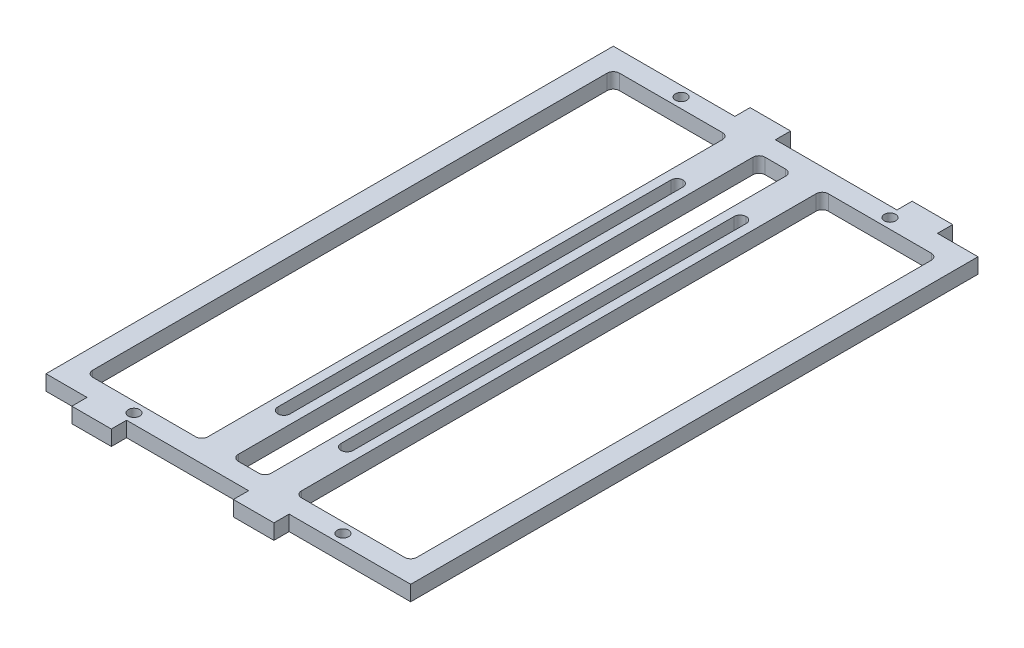
from build123d import *

# Parameters (mm, degrees)
SKETCH1_W                       = 114.3
SKETCH1_H                       = 177.8
SKETCH1_W_2                     = 101.6
SKETCH1_H_2                     = 165.1
BOSS_EXTRUDE1_DEPTH             = 4.7625
SKETCH2_W                       = 12.38677804
SKETCH2_H                       = 4.7625
SKETCH2_W_2                     = 12.7
BOSS_EXTRUDE2_DEPTH             = 4.7625
SKETCH3_W                       = 12.7
SKETCH3_H                       = 4.7625
BOSS_EXTRUDE3_DEPTH             = 4.7625
SKETCH4_W                       = 9.525
SKETCH4_H                       = 177.8
SKETCH4_W_2                     = 3.81
SKETCH4_H_2                     = 127
BOSS_EXTRUDE4_DEPTH             = 4.7625
FILLET1_R                       = 1.905
F_9_64_0_14063_DIAMETER_HOLE1_D = 3.572002


with BuildPart() as part:
    # Sketch1 → Boss-Extrude1 (new body)
    with BuildSketch(Plane(origin=(0, 0, 0), x_dir=(1, 0, 0), z_dir=(0, 1, 0))):
        Rectangle(SKETCH1_W, SKETCH1_H)
        Rectangle(SKETCH1_W_2, SKETCH1_H_2, mode=Mode.SUBTRACT)
    extrude(amount=BOSS_EXTRUDE1_DEPTH)

    # Sketch2 → Boss-Extrude2 (add)
    with BuildSketch(Plane.XY.offset(88.9)):
        with Locations((-38.1, 2.38125)):
            Rectangle(SKETCH2_W, SKETCH2_H)
        with Locations((12.7, 2.38125)):
            Rectangle(SKETCH2_W_2, SKETCH2_H)
    extrude(amount=BOSS_EXTRUDE2_DEPTH)

    # Sketch3 → Boss-Extrude3 (add)
    with BuildSketch(Plane(origin=(0, 0, -88.9), x_dir=(-1, 0, 0), z_dir=(0, 0, -1))):
        with Locations((-38.1, 2.38125)):
            Rectangle(SKETCH3_W, SKETCH3_H)
        with Locations((12.7, 2.38125)):
            Rectangle(SKETCH3_W, SKETCH3_H)
    extrude(amount=BOSS_EXTRUDE3_DEPTH)

    # Sketch4 → Boss-Extrude4 (add)
    # profile 1 of 2: a face of its own
    with BuildSketch(Plane(origin=(0, 4.7625, 0), x_dir=(-1, 0, 0), z_dir=(0, 1, 0))):
        with Locations((9.906, 0)):
            Rectangle(SKETCH4_W, SKETCH4_H)
        with Locations((9.906, 0)):
            Rectangle(SKETCH4_W_2, SKETCH4_H_2, mode=Mode.SUBTRACT)
    # profile 2 of 2: a face of its own
    with BuildSketch(Plane(origin=(0, 4.7625, 0), x_dir=(-1, 0, 0), z_dir=(0, 1, 0))):
        with Locations((-9.906, 0)):
            Rectangle(SKETCH4_W, SKETCH4_H)
        with Locations((-9.906, 0)):
            Rectangle(SKETCH4_W_2, SKETCH4_H_2, mode=Mode.SUBTRACT)
    extrude(amount=-BOSS_EXTRUDE4_DEPTH)

    # Fillet1
    fillet1_edges = [part.edges().sort_by_distance(p)[0] for p in [
        (-8.001, 2.38125, -63.5),
        (-11.811, 2.38125, -63.5),
        (8.001, 2.38125, -63.5),
        (11.811, 2.38125, -63.5),
        (-8.001, 2.38125, 63.5),
        (-11.811, 2.38125, 63.5),
        (8.001, 2.38125, 63.5),
        (11.811, 2.38125, 63.5),
        (-5.1435, 2.38125, 82.55),
        (5.1435, 2.38125, 82.55),
        (-5.1435, 2.38125, -82.55),
        (5.1435, 2.38125, -82.55),
        (-14.6685, 2.38125, -82.55),
        (-50.8, 2.38125, -82.55),
        (-50.8, 2.38125, 82.55),
        (-14.6685, 2.38125, 82.55),
        (14.6685, 2.38125, 82.55),
        (50.8, 2.38125, 82.55),
        (14.6685, 2.38125, -82.55),
        (50.8, 2.38125, -82.55),
    ]]
    fillet(fillet1_edges, radius=FILLET1_R - 0.0001)  # a hair under: the kernel refuses the full size

    # 9/64 (0.14063) Diameter Hole1 (through all)
    with Locations(Plane(origin=(0, 4.7625, 0), x_dir=(-1, 0, 0), z_dir=(0, 1, 0))):
        with Locations((32.73425, -85.725), (-32.73425, -85.725), (32.73425, 85.725), (-32.73425, 85.725)):
            Hole(F_9_64_0_14063_DIAMETER_HOLE1_D / 2)


solid = part.part
